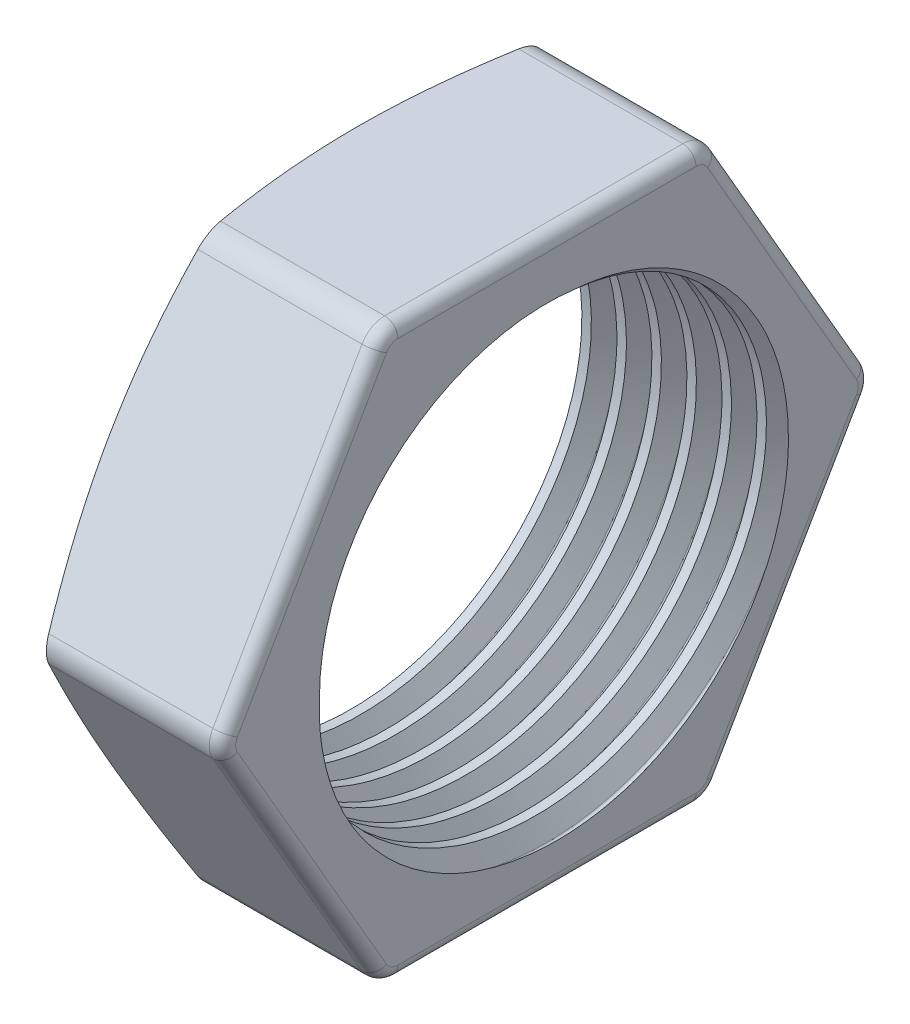
from build123d import *

# Parameters (mm, degrees)
BOSS_EXTRUDE1_START     = -6
BOSS_EXTRUDE1_DEPTH     = 24
CUT_EXTRUDE1_DEPTH      = 53.807038672
CUT_EXTRUDE1_DEPTH_BACK = 53.807038672
SKETCH3_R               = 25.985
CUT_SWEEP1_PITCH        = 4
FILLET1_R               = 3
FILLET2_R               = 1.5


with BuildPart() as part:
    # Sketch1 → Boss-Extrude1 (new body)
    with BuildSketch(Plane(origin=(0, 0, 0), x_dir=(0, 0, -1), z_dir=(1, 0, 0)).offset(BOSS_EXTRUDE1_START)):
        Polygon((18.763883749, -32.5), (37.527767497, 0), (18.763883749, 32.5), (-18.763883749, 32.5), (-37.527767497, 0), (-18.763883749, -32.5), align=None)
    extrude(amount=BOSS_EXTRUDE1_DEPTH)

    # Sketch2 → Cut-Revolve1 (revolve, cut)
    with BuildSketch(Plane.XY, mode=Mode.PRIVATE) as cut_revolve1_sk:
        Polygon((-20.781483827, 42.885496374), (-20.781483827, 0), (-15.609044162, 0), (0, 42.885496374), align=None)
    revolve(cut_revolve1_sk.sketch.rotate(Axis((-25.775631716, 0, 0), (1, 0, 0)), 270), axis=Axis((-25.775631716, 0, 0), (1, 0, 0)), mode=Mode.SUBTRACT)

    # Sketch3 → Cut-Extrude1 (cut, two sides: drawn at the far end of the back side and taken through both)
    with BuildSketch(Plane(origin=(0, 0, 0), x_dir=(0, 0, -1), z_dir=(1, 0, 0)).offset(-CUT_EXTRUDE1_DEPTH_BACK)):
        Circle(SKETCH3_R)
    extrude(amount=CUT_EXTRUDE1_DEPTH + CUT_EXTRUDE1_DEPTH_BACK, mode=Mode.SUBTRACT)

    # Cut-Sweep1: the profile of Sketch5 screwed along a right-hand helix of 8 turns, 12 arcs to a turn; built about Z, then put on its axis
    cut_sweep1_z = Axis((0, 0, 0), (0, 0, 1))
    cut_sweep1_corners = [(28.079038106, 0, -1.793264603), (25.530558608, 0, -3.264629927), (25.530558608, 0, 0.178100721), (28.079038106, 0, -1.293264603), (28.223375673, 0, -1.543264603)]
    with BuildLine(mode=Mode.PRIVATE) as cut_sweep1_profile:
        Line(cut_sweep1_corners[0], cut_sweep1_corners[1])
        Line(cut_sweep1_corners[1], cut_sweep1_corners[2])
        Line(cut_sweep1_corners[2], cut_sweep1_corners[3])
        ThreePointArc((28.079038106, 0, -1.293264603), (28.184700538, 0, -1.398927036), (28.223375673, 0, -1.543264603))
        ThreePointArc((28.223375673, 0, -1.543264603), (28.184700538, 0, -1.68760217), (28.079038106, 0, -1.793264603))
    cut_sweep1_cap = Face(cut_sweep1_profile.wire())
    cut_sweep1_arcs = [((28.079038106, 0, -1.293264603), (28.223375673, 0, -1.376597936), (28.223375673, 0, -1.543264603), (1, 0.8660254037848216, 1)), ((28.223375673, 0, -1.543264603), (28.223375673, 0, -1.70993127), (28.079038106, 0, -1.793264603), (1, 0.8660254037848216, 1))]  # start, shoulder, end, weights
    cut_sweep1_turn_angles = [0, 15, 30, 45, 60, 75, 90, 105, 120, 135, 150, 165, 180, 195, 210, 225, 240, 255, 270, 285, 300, 315, 330, 345, 360]
    cut_sweep1_turn_weights = [1, 0.9659258262890683, 1, 0.9659258262890683, 1, 0.9659258262890683, 1, 0.9659258262890683, 1, 0.9659258262890683, 1, 0.9659258262890683, 1, 0.9659258262890683, 1, 0.9659258262890683, 1, 0.9659258262890683, 1, 0.9659258262890683, 1, 0.9659258262890683, 1, 0.9659258262890683, 1]
    cut_sweep1_turn_rails = [Edge.make_bspline([Vector(p[0], p[1], 0).rotate(cut_sweep1_z, cut_sweep1_turn_angles[k]) / cut_sweep1_turn_weights[k] + Vector(0, 0, p[2] + CUT_SWEEP1_PITCH * cut_sweep1_turn_angles[k] / 360) for k in range(25)], [0, 0, 0, 1, 1, 2, 2, 3, 3, 4, 4, 5, 5, 6, 6, 7, 7, 8, 8, 9, 9, 10, 10, 11, 11, 12, 12, 12], 2, cut_sweep1_turn_weights) for p in cut_sweep1_corners]
    cut_sweep1_turn_sides = [*[Face.make_surface_from_curves(cut_sweep1_turn_rails[p[0]], cut_sweep1_turn_rails[p[1]]) for p in [(0, 1), (1, 2), (2, 3)]], *[Face.make_bezier_surface([[Vector(p[j][0], p[j][1], 0).rotate(cut_sweep1_z, cut_sweep1_turn_angles[2 * i + k]) / cut_sweep1_turn_weights[2 * i + k] + Vector(0, 0, p[j][2] + CUT_SWEEP1_PITCH * cut_sweep1_turn_angles[2 * i + k] / 360) for k in range(3)] for j in range(3)], [[p[3][j] * cut_sweep1_turn_weights[2 * i + k] for k in range(3)] for j in range(3)]) for p in cut_sweep1_arcs for i in range(12)]]
    cut_sweep1 = Plane(origin=(18, 0, 0), x_dir=(0, 1, 0), z_dir=(-1, 0, 0)) * Solid(Shell([*[p.moved(Location((0, 0, CUT_SWEEP1_PITCH * i))) for i in range(8) for p in cut_sweep1_turn_sides], cut_sweep1_cap, cut_sweep1_cap.rotate(cut_sweep1_z, 2880).moved(Location((0, 0, CUT_SWEEP1_PITCH * 2880 / 360)))]))
    add(cut_sweep1, mode=Mode.SUBTRACT)

    # Fillet1
    # the kernel refuses this fillet: 3 mm, written as the material it takes off along each edge
    with BuildSketch(Plane(origin=(-6.280180853, 0, 37.527767497), x_dir=(0, 0.8660254037844398, -0.49999999999999795), z_dir=(1, 0, 0)), Plane(origin=(-6.280180853, 32.5, 18.763883749), x_dir=(0, 0, -1), z_dir=(1, 0, 0)), Plane(origin=(-6.280180853, 0, -37.527767497), x_dir=(0, -0.8660254037844398, 0.49999999999999795), z_dir=(1, 0, 0)), Plane(origin=(-6.280180853, 32.5, -18.763883749), x_dir=(0, -0.8660254037844393, -0.49999999999999883), z_dir=(1, 0, 0))) as fillet1_piece_1:
        with BuildLine():
            CenterArc((FILLET1_R * 0.57735026919, -FILLET1_R), FILLET1_R, 90, 60)
            Line((-FILLET1_R * 0.288675134595, -FILLET1_R * 0.5), (0, 0))
            Line((0, 0), (FILLET1_R * 0.57735026919, 0))
        make_face()
    extrude(amount=28.610307872, mode=Mode.SUBTRACT)
    with BuildSketch(Plane(origin=(-6.280180853, -32.5, 18.763883749), x_dir=(0, 0, -1), z_dir=(1, 0, 0)), Plane(origin=(-6.280180853, -32.5, -18.763883749), x_dir=(0, 0.8660254037844389, -0.4999999999999995), z_dir=(1, 0, 0))) as fillet1_piece_2:
        with BuildLine():
            CenterArc((FILLET1_R * 0.57735026919, FILLET1_R), FILLET1_R, 210, 60)
            Line((-FILLET1_R * 0.288675134595, FILLET1_R * 0.5), (0, 0))
            Line((0, 0), (FILLET1_R * 0.57735026919, 0))
        make_face()
    extrude(amount=28.610307872, mode=Mode.SUBTRACT)

    # Fillet2
    fillet2_edges = [part.edges().sort_by_distance(p)[0] for p in [
        (18, -16.25, 28.145825623),
        (18, -32.5, 0),
        (18, -16.25, -28.145825623),
        (18, 16.25, -28.145825623),
        (18, 32.5, 0),
        (18, 16.25, 28.145825623),
        (18, 32.098076211, 18.531832941),
        (18, 0, 37.063665882),
        (18, 32.098076211, -18.531832941),
        (18, 0, -37.063665882),
        (18, -32.098076211, -18.531832941),
        (18, -32.098076211, 18.531832941),
    ]]
    fillet(fillet2_edges, radius=FILLET2_R)


solid = part.part
